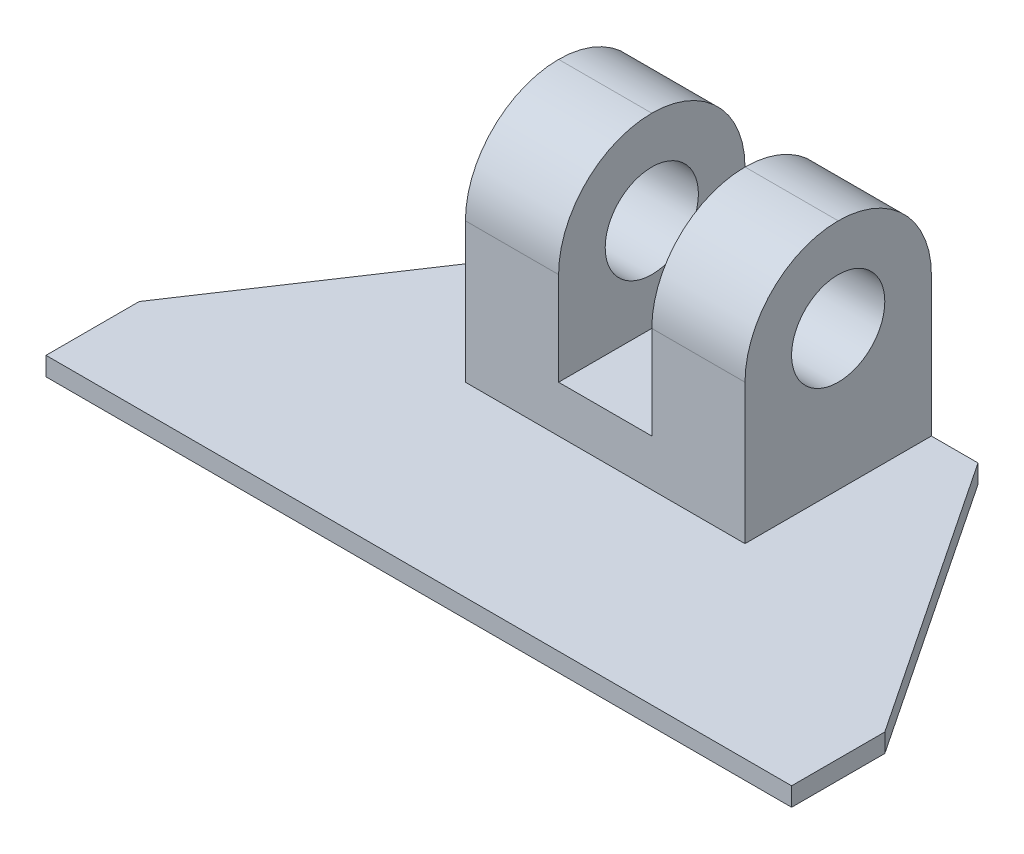
from build123d import *

# Parameters (mm, degrees)
SKETCH1_W           = 80
SKETCH1_H           = 40
BOSS_EXTRUDE1_DEPTH = 2
CUT_EXTRUDE1_DEPTH  = 5
SKETCH3_W           = 30
SKETCH3_H           = 20
BOSS_EXTRUDE2_DEPTH = 25
SKETCH4_R           = 5
CUT_EXTRUDE2_DEPTH  = 74.17103252
SKETCH5_W           = 10
SKETCH5_H           = 20
CUT_EXTRUDE3_DEPTH  = 20
FILLET1_R           = 10


with BuildPart() as part:
    # Sketch1 → Boss-Extrude1 (new body)
    with BuildSketch(Plane(origin=(0, 0, 0), x_dir=(1, 0, 0), z_dir=(0, 1, 0))):
        with Locations((-40, 20)):
            Rectangle(SKETCH1_W, SKETCH1_H)
    extrude(amount=BOSS_EXTRUDE1_DEPTH)

    # Sketch2 → Cut-Extrude1 (cut)
    with BuildSketch(Plane(origin=(0, 2, 0), x_dir=(1, 0, 0), z_dir=(0, 1, 0))):
        Polygon((-80, 10), (-60, 40), (-80, 40), align=None)
        Polygon((0, 10), (-20, 40), (0, 40), align=None)
    extrude(amount=-CUT_EXTRUDE1_DEPTH, mode=Mode.SUBTRACT)

    # Sketch3 → Boss-Extrude2 (add)
    with BuildSketch(Plane(origin=(0, 2, 0), x_dir=(1, 0, 0), z_dir=(0, 1, 0))):
        with Locations((-40, 30)):
            Rectangle(SKETCH3_W, SKETCH3_H)
    extrude(amount=BOSS_EXTRUDE2_DEPTH)

    # Sketch4 → Cut-Extrude2 (cut, through all)
    with BuildSketch(Plane(origin=(-25, 0, 0), x_dir=(0, 0, -1), z_dir=(1, 0, 0))):
        with Locations((30, 17)):
            Circle(SKETCH4_R)
    extrude(amount=-CUT_EXTRUDE2_DEPTH, mode=Mode.SUBTRACT)

    # Sketch5 → Cut-Extrude3 (cut)
    with BuildSketch(Plane(origin=(0, 27, 0), x_dir=(1, 0, 0), z_dir=(0, 1, 0))):
        with Locations((-40, 30)):
            Rectangle(SKETCH5_W, SKETCH5_H)
    extrude(amount=-CUT_EXTRUDE3_DEPTH, mode=Mode.SUBTRACT)

    # Fillet1
    fillet1_edges = [part.edges().sort_by_distance(p)[0] for p in [
        (-30, 27, -20),
        (-50, 27, -20),
        (-50, 27, -40),
        (-30, 27, -40),
    ]]
    fillet(fillet1_edges, radius=FILLET1_R - 0.0001)  # a hair under: the kernel refuses the full size


solid = part.part
